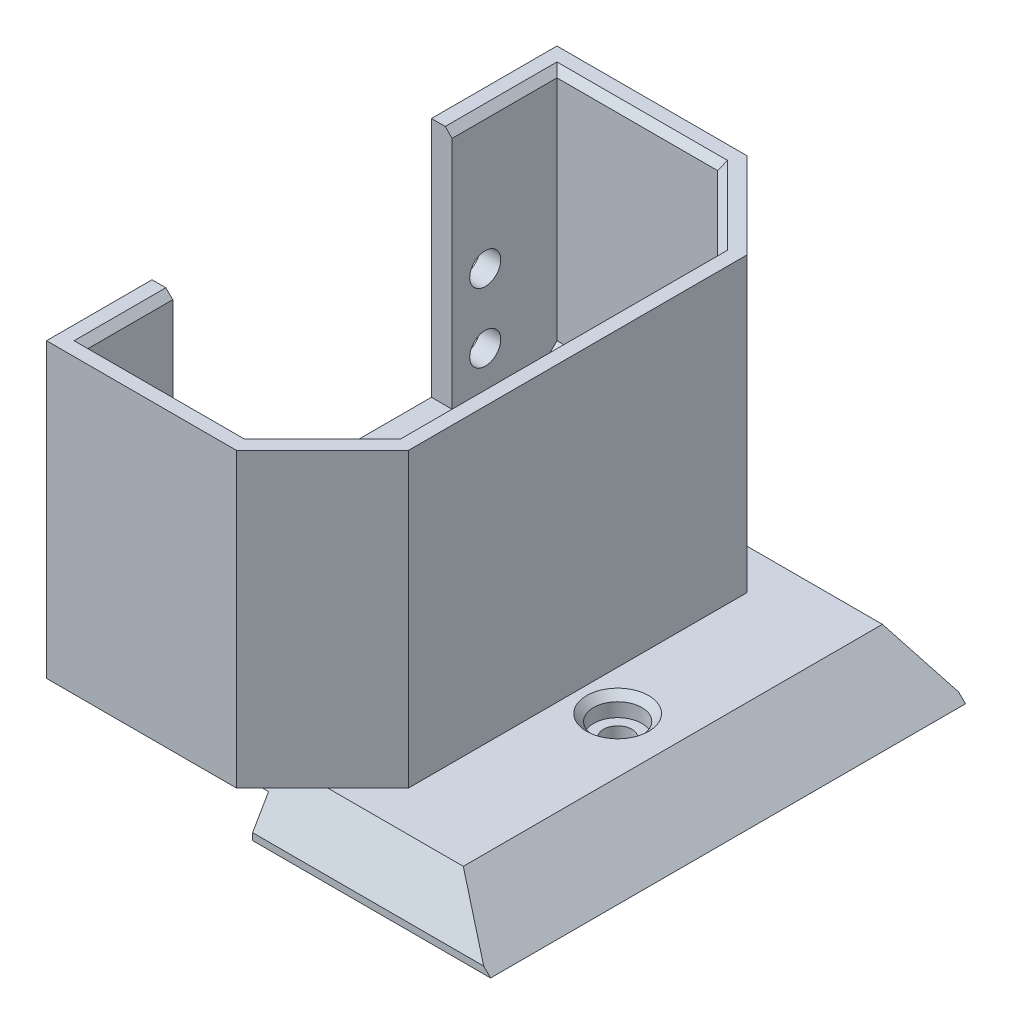
from build123d import *

# Parameters (mm, degrees)
MAIN_FACE_EXTRUDE_DEPTH              = 7.4
MAIN_WALLS_EXTRUDE_DEPTH             = 35
MAIN_WALLS_LOWER_CHAMFER_SIZE        = 1
MAIN_WALLS_ENTRY_CHAMFER_SIZE        = 1
SKETCH4_W                            = 3
SKETCH4_H                            = 40.5
SERVO_MOUNT_CUT_DEPTH                = 35
SERVO_MOUNT_HOLES_REACH              = 72.134
SKETCH5_R                            = 2.25
MOUNT_DOVETAIL_DEPTH                 = 61.8
MOUNT_DOVETAIL_CHAMFER_SIZE          = 8
SKETCH9_W                            = 27.3
SKETCH9_H                            = 68.845299462
DOVETAIL_OFFSET_CUT_DEPTH            = 5
SKETCH10_R                           = 2.05
MOUNT_SCREW_HOLE_DEPTH               = 72.175838597
SKETCH11_R                           = 3.5
MOUNT_SCREW_COUNTERSINK_DEPTH        = 3
MOUNT_SCREW_COUNTERSINK_CHAMFER_SIZE = 1
GEAR_CUT_DEPTH                       = 68.031634323
GEAR_ENTRY_CHAMFER_SIZE              = 3


with BuildPart() as part:
    # Sketch1 → Main Face Extrude (new body)
    with BuildSketch(Plane(origin=(0, 0, 0), x_dir=(1, 0, 0), z_dir=(0, 1, 0))):
        Polygon((-20, 35), (7.542640687, 35), (20, 22.542640687), (20, -26.542640687), (7.542640687, -39), (-20, -39), align=None)
    extrude(amount=MAIN_FACE_EXTRUDE_DEPTH)

    # Sketch3 → Main Walls Extrude (add)
    with BuildSketch(Plane(origin=(0, 7.4, 0), x_dir=(1, 0, 0), z_dir=(0, 1, 0))):
        Polygon((-20, 35), (-20, -39), (7.542640687, -39), (20, -26.542640687), (20, 22.542640687), (7.542640687, 35), align=None)
        Polygon((-17, 32), (-17, -36), (6.3, -36), (17, -25.3), (17, 21.3), (6.3, 32), align=None, mode=Mode.SUBTRACT)
    extrude(amount=MAIN_WALLS_EXTRUDE_DEPTH)

    # Main Walls Lower Chamfer
    main_walls_lower_chamfer_edges = [part.edges().sort_by_distance(p)[0] for p in [
        (-5.35, 7.4, -32),
        (-5.35, 7.4, 36),
        (11.65, 7.4, 30.65),
        (17, 7.4, 2),
        (11.65, 7.4, -26.65),
    ]]
    chamfer(main_walls_lower_chamfer_edges, length=MAIN_WALLS_LOWER_CHAMFER_SIZE)

    # Main Walls Entry Chamfer
    main_walls_entry_chamfer_edges = [part.edges().sort_by_distance(p)[0] for p in [
        (-5.35, 42.4, -32),
        (-17, 42.4, 2),
        (-5.35, 42.4, 36),
        (11.65, 42.4, 30.65),
        (17, 42.4, 2),
        (11.65, 42.4, -26.65),
    ]]
    chamfer(main_walls_entry_chamfer_edges, length=MAIN_WALLS_ENTRY_CHAMFER_SIZE)

    # Sketch4 → Servo Mount Cut (cut)
    with BuildSketch(Plane(origin=(0, 42.4, 0), x_dir=(1, 0, 0), z_dir=(0, 1, 0))):
        with Locations((-18.5, -3.45)):
            Rectangle(SKETCH4_W, SKETCH4_H)
    extrude(amount=-SERVO_MOUNT_CUT_DEPTH, mode=Mode.SUBTRACT)

    # Sketch5 → Servo Mount Holes (cut, up to next)
    with BuildSketch(Plane.ZY.offset(20), mode=Mode.PRIVATE) as servo_mount_holes_sk1:
        with Locations((-21.6, 22.65)):
            Circle(SKETCH5_R)
    servo_mount_holes_tool1 = extrude(servo_mount_holes_sk1.sketch, amount=-SERVO_MOUNT_HOLES_REACH, mode=Mode.PRIVATE) & part.part
    # Sketch5 → Servo Mount Holes (cut, up to next)
    with BuildSketch(Plane.ZY.offset(20), mode=Mode.PRIVATE) as servo_mount_holes_sk2:
        with Locations((-21.6, 12.65)):
            Circle(SKETCH5_R)
    servo_mount_holes_tool2 = extrude(servo_mount_holes_sk2.sketch, amount=-SERVO_MOUNT_HOLES_REACH, mode=Mode.PRIVATE) & part.part
    # Sketch5 → Servo Mount Holes (cut, up to next)
    with BuildSketch(Plane.ZY.offset(20), mode=Mode.PRIVATE) as servo_mount_holes_sk3:
        with Locations((28.5, 22.65)):
            Circle(SKETCH5_R)
    servo_mount_holes_tool3 = extrude(servo_mount_holes_sk3.sketch, amount=-SERVO_MOUNT_HOLES_REACH, mode=Mode.PRIVATE) & part.part
    # Sketch5 → Servo Mount Holes (cut, up to next)
    with BuildSketch(Plane.ZY.offset(20), mode=Mode.PRIVATE) as servo_mount_holes_sk4:
        with Locations((28.5, 12.65)):
            Circle(SKETCH5_R)
    servo_mount_holes_tool4 = extrude(servo_mount_holes_sk4.sketch, amount=-SERVO_MOUNT_HOLES_REACH, mode=Mode.PRIVATE) & part.part
    add(servo_mount_holes_tool1.solids().sort_by_distance((-20, 22.65, -21.6))[0], mode=Mode.SUBTRACT)
    add(servo_mount_holes_tool2.solids().sort_by_distance((-20, 12.65, -21.6))[0], mode=Mode.SUBTRACT)
    add(servo_mount_holes_tool3.solids().sort_by_distance((-20, 22.65, 28.5))[0], mode=Mode.SUBTRACT)
    add(servo_mount_holes_tool4.solids().sort_by_distance((-20, 12.65, 28.5))[0], mode=Mode.SUBTRACT)

    # Sketch8 → Mount Dovetail (add)
    with BuildSketch(Plane.ZY.offset(20)):
        Polygon((-28.381197846, 0), (-32.422649731, -7), (-32.422649731, -8), (36.422649731, -8), (36.422649731, -7), (32.381197846, 0), align=None)
    extrude(amount=-MOUNT_DOVETAIL_DEPTH)

    # Mount Dovetail Chamfer
    mount_dovetail_chamfer_edges = [part.edges().sort_by_distance(p)[0] for p in [
        (41.8, 0, 2),
    ]]
    chamfer(mount_dovetail_chamfer_edges, length=MOUNT_DOVETAIL_CHAMFER_SIZE - 0.0001)  # a hair under: the kernel refuses the full size

    # Sketch9 → Dovetail Offset Cut (cut)
    with BuildSketch(Plane.XZ.offset(8)):
        with Locations((-6.35, 2)):
            Rectangle(SKETCH9_W, SKETCH9_H)
    extrude(amount=-DOVETAIL_OFFSET_CUT_DEPTH, mode=Mode.SUBTRACT)

    # Sketch10 → Mount Screw Hole (cut, through all)
    with BuildSketch(Plane(origin=(0, 0, 0), x_dir=(1, 0, 0), z_dir=(0, 1, 0))):
        with Locations(Location((25.8, -2, 0), (0, 0, 270))):
            Circle(SKETCH10_R)
    extrude(amount=-MOUNT_SCREW_HOLE_DEPTH, mode=Mode.SUBTRACT)

    # Sketch11 → Mount Screw Countersink (cut)
    with BuildSketch(Plane(origin=(0, 0, 0), x_dir=(1, 0, 0), z_dir=(0, 1, 0))):
        with Locations(Location((25.8, -2, 0), (0, 0, 270))):
            Circle(SKETCH11_R)
    extrude(amount=-MOUNT_SCREW_COUNTERSINK_DEPTH, mode=Mode.SUBTRACT)

    # Mount Screw Countersink Chamfer
    mount_screw_countersink_chamfer_edges = [part.edges().sort_by_distance(p)[0] for p in [
        (25.8, 0, -1.5),
    ]]
    chamfer(mount_screw_countersink_chamfer_edges, length=MOUNT_SCREW_COUNTERSINK_CHAMFER_SIZE)

    # Sketch2 → Gear Cut (cut, through all)
    with BuildSketch(Plane(origin=(0, 7.4, 0), x_dir=(1, 0, 0), z_dir=(0, 1, 0))):
        Polygon((-1.7, 26.5), (5.3, 26.5), (7.3, 24.5), (7.3, -11.5), (5.3, -13.5), (-1.7, -13.5), (-3.7, -11.5), (-3.7, 24.5), align=None)
    extrude(amount=-GEAR_CUT_DEPTH, mode=Mode.SUBTRACT)

    # Gear Entry Chamfer
    gear_entry_chamfer_edges = [part.edges().sort_by_distance(p)[0] for p in [
        (-2.7, 7.4, -25.5),
        (-3.7, 7.4, -6.5),
        (-2.7, 7.4, 12.5),
        (1.8, 7.4, 13.5),
        (6.3, 7.4, 12.5),
        (7.3, 7.4, -6.5),
        (6.3, 7.4, -25.5),
        (1.8, 7.4, -26.5),
    ]]
    chamfer(gear_entry_chamfer_edges, length=GEAR_ENTRY_CHAMFER_SIZE)


solid = part.part
